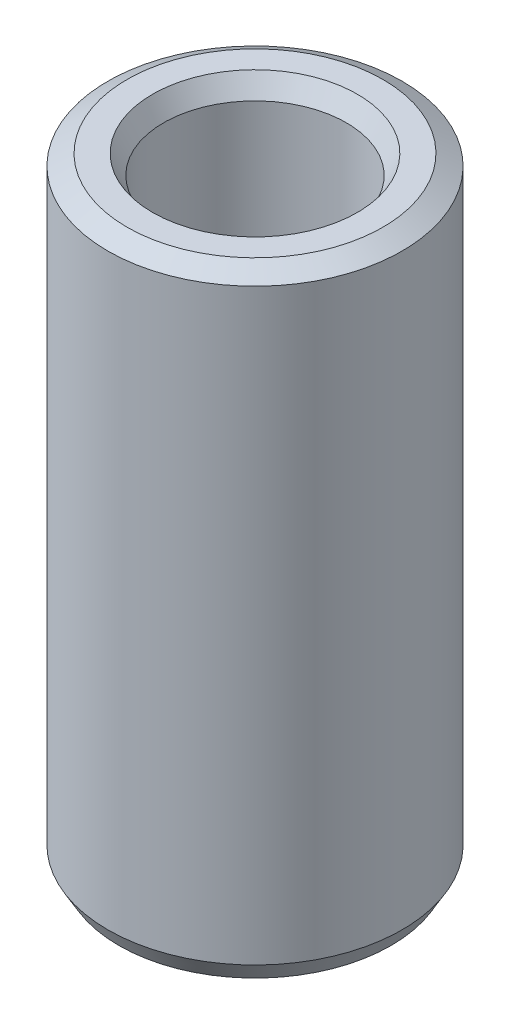
from build123d import *
from OCP.BRepFilletAPI import BRepFilletAPI_MakeChamfer

# Parameters (mm, degrees)
SKETCH1_R           = 30
BOSS_EXTRUDE1_DEPTH = 126.01468125
SKETCH2_R           = 18.630001178
CUT_EXTRUDE1_DEPTH  = 133.965032586
CHAMFER1_SIZE       = 2.255256992
CHAMFER1_SIZE2      = 3.906219694


with BuildPart() as part:
    # Sketch1 → Boss-Extrude1 (new body)
    with BuildSketch(Plane(origin=(0, 0, 0), x_dir=(1, 0, 0), z_dir=(0, 1, 0))):
        Circle(SKETCH1_R)
    extrude(amount=BOSS_EXTRUDE1_DEPTH)

    # Sketch2 → Cut-Extrude1 (cut, through all)
    with BuildSketch(Plane(origin=(0, 0, 0), x_dir=(1, 0, 0), z_dir=(0, 1, 0))):
        Circle(SKETCH2_R)
    extrude(amount=CUT_EXTRUDE1_DEPTH, mode=Mode.SUBTRACT)

    # Chamfer1: one chamfer whose edges measure the first distance from different faces: ONE call of the kernel's chamfer builder (chamfer() names one face for all edges)
    chamfer1_edges_1 = [part.edges().sort_by_distance(p)[0] for p in [
        (-18.630001178, 126.01468125, 0),
    ]]
    chamfer1_side_1 = [part.faces().sort_by_distance(p)[0] for p in [
        (-29.151471863, 126.01468125, 0),
    ]]
    chamfer1_edges_2 = [part.edges().sort_by_distance(p)[0] for p in [
        (-18.630001178, 0, 0),
    ]]
    chamfer1_side_2 = [part.faces().sort_by_distance(p)[0] for p in [
        (-18.630001178, 63.007340625, 0),
    ]]
    chamfer1_edges_3 = [part.edges().sort_by_distance(p)[0] for p in [
        (-30, 0, 0),
    ]]
    chamfer1_side_3 = [part.faces().sort_by_distance(p)[0] for p in [
        (-29.151471863, 0, 0),
    ]]
    chamfer1_edges_4 = [part.edges().sort_by_distance(p)[0] for p in [
        (-30, 126.01468125, 0),
    ]]
    chamfer1_side_4 = [part.faces().sort_by_distance(p)[0] for p in [
        (-30, 63.007340625, 0),
    ]]
    chamfer1 = BRepFilletAPI_MakeChamfer(part.part.solid().wrapped)
    for e in chamfer1_edges_1:
        chamfer1.Add(CHAMFER1_SIZE, CHAMFER1_SIZE2, e.wrapped, chamfer1_side_1[0].wrapped)  # the first distance lies on this face
    for e in chamfer1_edges_2:
        chamfer1.Add(CHAMFER1_SIZE, CHAMFER1_SIZE2, e.wrapped, chamfer1_side_2[0].wrapped)  # the first distance lies on this face
    for e in chamfer1_edges_3:
        chamfer1.Add(CHAMFER1_SIZE, CHAMFER1_SIZE2, e.wrapped, chamfer1_side_3[0].wrapped)  # the first distance lies on this face
    for e in chamfer1_edges_4:
        chamfer1.Add(CHAMFER1_SIZE, CHAMFER1_SIZE2, e.wrapped, chamfer1_side_4[0].wrapped)  # the first distance lies on this face
    add(Compound.cast(chamfer1.Shape()), mode=Mode.REPLACE)


solid = part.part
